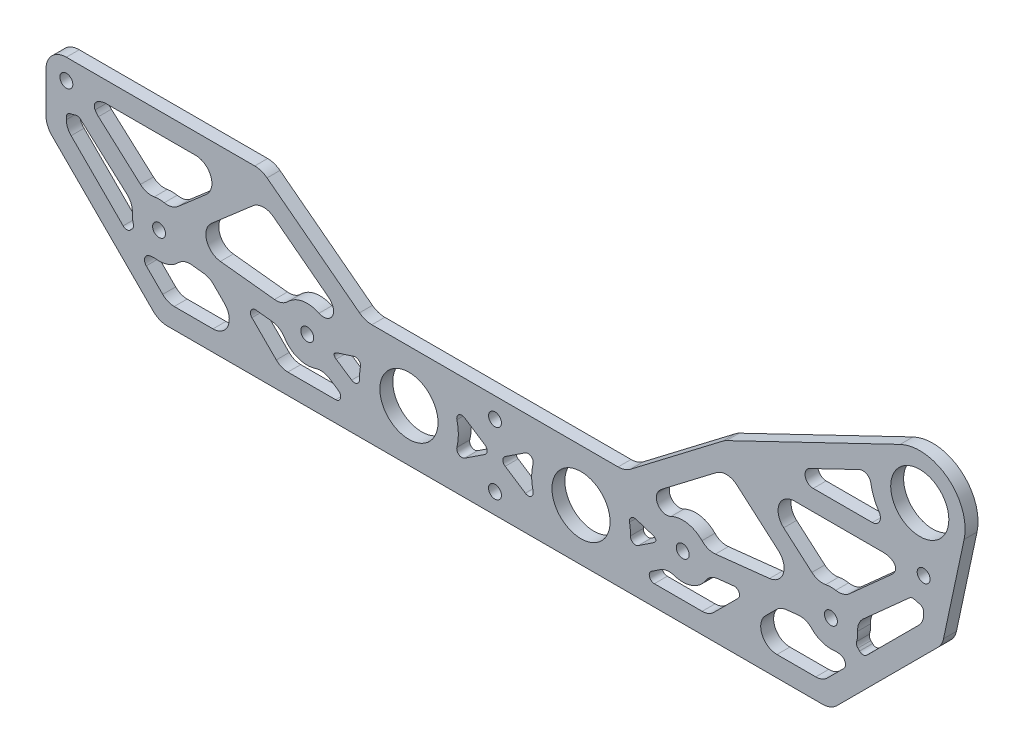
from build123d import *

# Parameters (mm, degrees)
SKETCH1_R           = 14.2875
SKETCH1_R_2         = 3.175
BOSS_EXTRUDE1_DEPTH = 6.35
FILLET1_R           = 10
CUT_EXTRUDE1_DEPTH  = 10
FILLET2_R           = 2.5
FILLET3_DEPTH       = 6.35
FILLET4_R           = 8
FILLET5_R           = 8
FILLET6_R           = 3
FILLET7_R           = 8
FILLET8_R           = 5
FILLET9_R           = 3
FILLET10_R          = 8
BOSS_EXTRUDE2_START = -6.35
SKETCH3_R           = 14.2875
BOSS_EXTRUDE2_DEPTH = 6.35
CUT_EXTRUDE2_DEPTH  = 10
FILLET11_R          = 4


with BuildPart() as part:
    # Sketch1 → Boss-Extrude1 (new body)
    with BuildSketch(Plane.XY):
        Polygon((-62.442934658, -37.279495554), (267.757065342, -37.279495554), (323.315335232, 18.278774336), (323.315335232, 52.320504446), (217.352871158, 52.320504446), (166.552871158, 13.520504446), (38.761259526, 13.520504446), (-12.038740474, 52.320504446), (-118.001204548, 52.320504446), (-118.001204548, 18.278774336), align=None)
        with Locations((60.373820223, -11.879495554)):
            Circle(SKETCH1_R, mode=Mode.SUBTRACT)
        with Locations((-62.442934658, 1.520504446)):
            Circle(SKETCH1_R_2, mode=Mode.SUBTRACT)
        with Locations((10.373820223, -6.424213816)):
            Circle(SKETCH1_R_2, mode=Mode.SUBTRACT)
        with Locations((102.657065342, -27.279495554)):
            Circle(SKETCH1_R_2, mode=Mode.SUBTRACT)
        with Locations((144.940310462, -11.879495554)):
            Circle(SKETCH1_R, mode=Mode.SUBTRACT)
        with Locations((194.940310462, -6.424213816)):
            Circle(SKETCH1_R_2, mode=Mode.SUBTRACT)
        with Locations((102.657065342, 3.520504446)):
            Circle(SKETCH1_R_2, mode=Mode.SUBTRACT)
        with Locations((267.757065342, 1.520504446)):
            Circle(SKETCH1_R_2, mode=Mode.SUBTRACT)
        with Locations((313.315335232, 42.320504446)):
            Circle(SKETCH1_R_2, mode=Mode.SUBTRACT)
        with Locations((-108.001204548, 42.320504446)):
            Circle(SKETCH1_R_2, mode=Mode.SUBTRACT)
    extrude(amount=BOSS_EXTRUDE1_DEPTH)

    # Fillet1
    fillet1_edges = [part.edges().sort_by_distance(p)[0] for p in [
        (-118.001204548, 18.278774336, 3.175),
        (-118.001204548, 52.320504446, 3.175),
        (-12.038740474, 52.320504446, 3.175),
        (38.761259526, 13.520504446, 3.175),
        (166.552871158, 13.520504446, 3.175),
        (217.352871158, 52.320504446, 3.175),
        (323.315335232, 52.320504446, 3.175),
        (323.315335232, 18.278774336, 3.175),
        (267.757065342, -37.279495554, 3.175),
        (-62.442934658, -37.279495554, 3.175),
    ]]
    fillet(fillet1_edges, radius=FILLET1_R)

    # Sketch2 → Cut-Extrude1 (cut)
    with BuildSketch(Plane.XY.offset(6.35)):
        with BuildLine():
            ThreePointArc((23.505920872, -7.486549706), (23.419545179, -8.265323632), (23.28702714, -9.037585605))
            Line((23.28702714, -9.037585605), (36.905820905, -18.135345959))
            ThreePointArc((36.905820905, -18.135345959), (36.127690836, -10.462503664), (37.794303215, -2.932536966))
            Line((37.794303215, -2.932536966), (23.505920872, -7.486549706))
        make_face()
        with BuildLine():
            Line((-74.858923583, 5.927753475), (-102.256554243, 30.463876853))
            ThreePointArc((-102.256554243, 30.463876853), (-105.054209768, 29.479326667), (-108.001204548, 29.145504446))
            Line((-108.001204548, 29.145504446), (-108.001204548, 22.42090996))
            Line((-108.001204548, 22.42090996), (-78.307400752, -7.272893836))
            Line((-78.307400752, -7.272893836), (-74.597651385, -3.563144469))
            ThreePointArc((-74.597651385, -3.563144469), (-75.612945288, 1.157951013), (-74.858923583, 5.927753475))
        make_face()
        with BuildLine():
            Line((-23.050139283, 42.320504446), (-94.826204548, 42.320504446))
            ThreePointArc((-94.826204548, 42.320504446), (-95.017343814, 40.084439722), (-95.585215622, 37.913255418))
            Line((-95.585215622, 37.913255418), (-68.187584962, 13.377132039))
            ThreePointArc((-68.187584962, 13.377132039), (-62.339595002, 14.695099162), (-56.512999229, 13.285558242))
            Line((-56.512999229, 13.285558242), (-23.050139283, 42.320504446))
        make_face()
        with BuildLine():
            Line((-67.526583573, -10.63421228), (-71.23633294, -14.343961648))
            Line((-71.23633294, -14.343961648), (-58.300799034, -27.279495554))
            Line((-58.300799034, -27.279495554), (-16.619224161, -27.279495554))
            Line((-16.619224161, -27.279495554), (-37.688728757, -6.209990957))
            Line((-37.688728757, -6.209990957), (-50.867789262, -4.772081195))
            ThreePointArc((-50.867789262, -4.772081195), (-58.069603335, -10.907471984), (-67.526583573, -10.63421228))
        make_face()
        with BuildLine():
            Line((30.003625706, 7.626245825), (-11.363222422, 39.221397545))
            Line((-11.363222422, 39.221397545), (-49.959338032, 5.732444651))
            ThreePointArc((-49.959338032, 5.732444651), (-49.868096719, 5.45167168), (-49.783169494, 5.168924788))
            Line((-49.783169494, 5.168924788), (-1.201325173, -0.131628174))
            ThreePointArc((-1.201325173, -0.131628174), (9.059387493, 6.685053578), (20.46921657, 2.041221648))
            Line((20.46921657, 2.041221648), (32.642653903, 5.921156225))
            ThreePointArc((32.642653903, 5.921156225), (31.289604918, 6.721797881), (30.003625706, 7.626245825))
        make_face()
        with BuildLine():
            Line((-21.814640677, -7.941943413), (-2.477088537, -27.279495554))
            Line((-2.477088537, -27.279495554), (32.591759865, -27.279495554))
            Line((32.591759865, -27.279495554), (17.732180345, -17.352853315))
            ThreePointArc((17.732180345, -17.352853315), (5.870863239, -18.805813204), (-2.285944941, -10.072634157))
            Line((-2.285944941, -10.072634157), (-21.814640677, -7.941943413))
        make_face()
        with BuildLine():
            Line((187.581950339, -17.352853315), (172.722370819, -27.279495554))
            Line((172.722370819, -27.279495554), (207.791219222, -27.279495554))
            Line((207.791219222, -27.279495554), (227.128771362, -7.941943413))
            Line((227.128771362, -7.941943413), (207.600075626, -10.072634157))
            ThreePointArc((207.600075626, -10.072634157), (199.443267446, -18.805813204), (187.581950339, -17.352853315))
        make_face()
        with BuildLine():
            Line((243.002859442, -6.209990957), (221.933354845, -27.279495554))
            Line((221.933354845, -27.279495554), (263.614929719, -27.279495554))
            Line((263.614929719, -27.279495554), (276.550463625, -14.343961648))
            Line((276.550463625, -14.343961648), (272.840714257, -10.63421228))
            ThreePointArc((272.840714257, -10.63421228), (263.38373402, -10.907471984), (256.181919946, -4.772081195))
            Line((256.181919946, -4.772081195), (243.002859442, -6.209990957))
        make_face()
        with BuildLine():
            Line((168.408309779, -18.135345959), (182.027103545, -9.037585605))
            ThreePointArc((182.027103545, -9.037585605), (181.894585505, -8.265323632), (181.808209813, -7.486549706))
            Line((181.808209813, -7.486549706), (167.519827469, -2.932536966))
            ThreePointArc((167.519827469, -2.932536966), (169.186439849, -10.462503664), (168.408309779, -18.135345959))
        make_face()
        with BuildLine():
            ThreePointArc((175.310504979, 7.626245825), (174.024525767, 6.721797881), (172.671476782, 5.921156225))
            Line((172.671476782, 5.921156225), (184.844914115, 2.041221648))
            ThreePointArc((184.844914115, 2.041221648), (196.254743191, 6.685053578), (206.515455858, -0.131628174))
            Line((206.515455858, -0.131628174), (255.097300178, 5.168924788))
            ThreePointArc((255.097300178, 5.168924788), (255.182227404, 5.45167168), (255.273468717, 5.732444651))
            Line((255.273468717, 5.732444651), (216.677353107, 39.221397545))
            Line((216.677353107, 39.221397545), (175.310504979, 7.626245825))
        make_face()
        with BuildLine():
            Line((279.911782069, -3.563144469), (283.621531436, -7.272893836))
            Line((283.621531436, -7.272893836), (313.315335232, 22.42090996))
            Line((313.315335232, 22.42090996), (313.315335232, 29.145504446))
            ThreePointArc((313.315335232, 29.145504446), (310.368340453, 29.479326667), (307.570684928, 30.463876853))
            Line((307.570684928, 30.463876853), (280.173054268, 5.927753475))
            ThreePointArc((280.173054268, 5.927753475), (280.927075973, 1.157951013), (279.911782069, -3.563144469))
        make_face()
        with BuildLine():
            Line((228.364269968, 42.320504446), (261.827129914, 13.285558242))
            ThreePointArc((261.827129914, 13.285558242), (267.653725687, 14.695099162), (273.501715647, 13.377132039))
            Line((273.501715647, 13.377132039), (300.899346307, 37.913255418))
            ThreePointArc((300.899346307, 37.913255418), (300.331474499, 40.084439722), (300.140335232, 42.320504446))
            Line((300.140335232, 42.320504446), (228.364269968, 42.320504446))
        make_face()
        with BuildLine():
            Line((124.499254422, 1.237130698), (104.481636284, -11.879495554))
            Line((104.481636284, -11.879495554), (124.499254422, -24.996121805))
            ThreePointArc((124.499254422, -24.996121805), (120.652810462, -11.879495554), (124.499254422, 1.237130698))
        make_face()
        with BuildLine():
            Line((100.832494401, -11.879495554), (80.814876263, 1.237130698))
            ThreePointArc((80.814876263, 1.237130698), (84.661320223, -11.879495554), (80.814876263, -24.996121805))
            Line((80.814876263, -24.996121805), (100.832494401, -11.879495554))
        make_face()
    extrude(amount=-CUT_EXTRUDE1_DEPTH, mode=Mode.SUBTRACT)

    # Fillet2
    # the kernel refuses this fillet: 2.5 mm, written as the material it adds along each edge
    with BuildSketch(Plane(origin=(124.499254422, -24.996121805, 6.35), x_dir=(-0.8364298099761919, 0.5480740579366914, 0), z_dir=(0, 0, -1)), Plane(origin=(80.814876263, 1.237130698, 6.35), x_dir=(0.8364298099761912, -0.5480740579366923, 0), z_dir=(0, 0, -1))) as fillet2_piece_1:
        with BuildLine():
            CenterArc((8.270761151, 2.5), FILLET2_R, 132.738385679, 137.261614321)
            ThreePointArc((6.574131455, 4.336150232), (3.463988922, 1.899838021), (0, 0))
            Line((0, 0), (8.270761151, 0))
        make_face()
    extrude(amount=6.35)
    with BuildSketch(Plane(origin=(104.481636284, -11.879495554, 6.35), x_dir=(0.836429809976191, 0.5480740579366925, 0), z_dir=(0, 0, -1)), Plane(origin=(100.832494401, -11.879495554, 6.35), x_dir=(-0.836429809976192, -0.5480740579366911, 0), z_dir=(0, 0, -1))) as fillet2_piece_2:
        with BuildLine():
            CenterArc((FILLET2_R * 1.52612552604, FILLET2_R), FILLET2_R, 156.469970738, 113.530029262)
            Line((FILLET2_R * 0.609274565772, FILLET2_R * 1.39922965403), (0, 0))
            Line((0, 0), (FILLET2_R * 1.52612552604, 0))
        make_face()
    extrude(amount=6.35)
    with BuildSketch(Plane(origin=(124.499254422, 1.237130698, 6.35), x_dir=(-0.8364298099761911, -0.5480740579366926, 0), z_dir=(0, 0, -1)), Plane(origin=(80.814876263, -24.996121805, 6.35), x_dir=(0.8364298099761913, 0.5480740579366921, 0), z_dir=(0, 0, -1))) as fillet2_piece_3:
        with BuildLine():
            CenterArc((8.270761151, -2.5), FILLET2_R, 90, 137.261614321)
            ThreePointArc((6.574131455, -4.336150232), (3.463988922, -1.899838021), (0, 0))
            Line((0, 0), (8.270761151, 0))
        make_face()
    extrude(amount=6.35)
    with BuildSketch(Plane(origin=(36.905820905, -18.135345959, 6.35), x_dir=(-0.8315267709778132, 0.5554846794891928, 0), z_dir=(0, 0, -1))) as fillet2_piece_4:
        with BuildLine():
            CenterArc((5.637586761, 2.5), FILLET2_R, 144.019234869, 125.980765131)
            ThreePointArc((3.614551073, 3.968784057), (1.917261006, 1.884223289), (0, 0))
            Line((0, 0), (5.637586761, 0))
        make_face()
    extrude(amount=6.35)
    with BuildSketch(Plane(origin=(37.794303215, -2.932536966, 6.35), x_dir=(-0.9527771354410546, -0.3036704302047504, 0), z_dir=(0, 0, -1))) as fillet2_piece_5:
        with BuildLine():
            CenterArc((4.690805929, -2.5), FILLET2_R, 90, 118.741955759)
            ThreePointArc((2.498820236, -3.702164183), (1.334695889, -1.793517434), (0, 0))
            Line((0, 0), (4.690805929, 0))
        make_face()
    extrude(amount=6.35)
    with BuildSketch(Plane(origin=(23.28702714, -9.037585605, 6.35), x_dir=(0.14435302535723496, 0.989526252340085, 0), z_dir=(0, 0, -1)), Plane(origin=(181.808209813, -7.486549706, 6.35), x_dir=(0.13512930422682767, -0.9908279725255911, 0), z_dir=(0, 0, -1)), Plane(origin=(307.570684928, 30.463876853, 6.35), x_dir=(0.9224742738611128, -0.3860585629984297, 0), z_dir=(0, 0, -1))) as fillet2_piece_6:
        with BuildLine():
            CenterArc((1.580869434, 2.496243903), FILLET2_R, 205.444288667, 61.414548907)
            Line((-0.676639225, 1.422160733), (0, 0))
            ThreePointArc((0, 0), (0.721939507, 0.019794629), (1.443879015, 0))
        make_face()
    extrude(amount=6.35)
    with BuildSketch(Plane(origin=(23.505920872, -7.486549706, 6.35), x_dir=(0.9527771354410546, 0.3036704302047506, 0), z_dir=(0, 0, -1)), Plane(origin=(182.027103545, -9.037585605, 6.35), x_dir=(-0.8315267709778119, -0.5554846794891947, 0), z_dir=(0, 0, -1)), Plane(origin=(-74.597651385, -3.563144469, 6.35), x_dir=(-0.7071067811865465, -0.7071067811865487, 0), z_dir=(0, 0, -1)), Plane(origin=(-102.256554243, 30.463876853, 6.35), x_dir=(0.7449378564648427, -0.667133862133804, 0), z_dir=(0, 0, -1))) as fillet2_piece_7:
        with BuildLine():
            CenterArc((1.574922789, 2.5), FILLET2_R, 208.585451093, 61.414548907)
            ThreePointArc((-0.62033846, 1.303827751), (-0.292294611, 0.660418307), (0, 0))
            Line((0, 0), (1.574922789, 0))
        make_face()
    extrude(amount=6.35)
    with BuildSketch(Plane(origin=(168.408309779, -18.135345959, 6.35), x_dir=(0.8315267709778126, 0.555484679489194, 0), z_dir=(0, 0, -1))) as fillet2_piece_8:
        with BuildLine():
            CenterArc((5.637586761, -2.5), FILLET2_R, 90, 125.980765131)
            ThreePointArc((3.614551073, -3.968784057), (1.917261006, -1.884223289), (0, 0))
            Line((0, 0), (5.637586761, 0))
        make_face()
    extrude(amount=6.35)
    with BuildSketch(Plane(origin=(167.519827469, -2.932536966, 6.35), x_dir=(0.9527771354410542, -0.3036704302047514, 0), z_dir=(0, 0, -1))) as fillet2_piece_9:
        with BuildLine():
            CenterArc((4.690805929, 2.5), FILLET2_R, 151.258044241, 118.741955759)
            ThreePointArc((2.498820236, 3.702164183), (1.334695889, 1.793517434), (0, 0))
            Line((0, 0), (4.690805929, 0))
        make_face()
    extrude(amount=6.35)
    with BuildSketch(Plane(origin=(-21.814640677, -7.941943413, 6.35), x_dir=(0.9941005983250841, -0.10846197679237511, 0), z_dir=(0, 0, -1)), Plane(origin=(227.128771362, -7.941943413, 6.35), x_dir=(-0.7071067811865478, -0.7071067811865472, 0), z_dir=(0, 0, -1))) as fillet2_piece_10:
        with BuildLine():
            CenterArc((FILLET2_R * 2.8417642098, FILLET2_R), FILLET2_R, 128.773337141, 141.226662859)
            Line((FILLET2_R * 2.21552313484, FILLET2_R * 1.77962947355), (0, 0))
            Line((0, 0), (FILLET2_R * 2.8417642098, 0))
        make_face()
    extrude(amount=6.35)
    with BuildSketch(Plane(origin=(32.591759865, -27.279495554, 6.35), x_dir=(-1, 0, 0), z_dir=(0, 0, -1)), Plane(origin=(172.722370819, -27.279495554, 6.35), x_dir=(0.8315267709778129, 0.5554846794891936, 0), z_dir=(0, 0, -1))) as fillet2_piece_11:
        with BuildLine():
            CenterArc((FILLET2_R * 3.2971688304, FILLET2_R), FILLET2_R, 123.74410479, 146.25589521)
            Line((FILLET2_R * 2.74168415091, FILLET2_R * 1.83152677098), (0, 0))
            Line((0, 0), (FILLET2_R * 3.2971688304, 0))
        make_face()
    extrude(amount=6.35)
    with BuildSketch(Plane(origin=(279.911782069, -3.563144469, 6.35), x_dir=(0.7071067811865567, -0.7071067811865384, 0), z_dir=(0, 0, -1))) as fillet2_piece_12:
        with BuildLine():
            CenterArc((1.574922789, -2.5), FILLET2_R, 90, 61.414548907)
            ThreePointArc((-0.62033846, -1.303827751), (-0.292294611, -0.660418307), (0, 0))
            Line((0, 0), (1.574922789, 0))
        make_face()
    extrude(amount=6.35)
    with BuildSketch(Plane(origin=(283.621531436, -7.272893836, 6.35), x_dir=(-0.707106781186556, 0.7071067811865389, 0), z_dir=(0, 0, -1))) as fillet2_piece_13:
        with BuildLine():
            CenterArc((FILLET2_R, FILLET2_R), FILLET2_R, 180, 90)
            Line((0, FILLET2_R), (0, 0))
            Line((0, 0), (FILLET2_R, 0))
        make_face()
    extrude(amount=6.35)
    with BuildSketch(Plane(origin=(-78.307400752, -7.272893836, 6.35), x_dir=(0.7071067811865476, 0.7071067811865476, 0), z_dir=(0, 0, -1))) as fillet2_piece_14:
        with BuildLine():
            CenterArc((FILLET2_R, -FILLET2_R), FILLET2_R, 90, 90)
            Line((0, -FILLET2_R), (0, 0))
            Line((0, 0), (FILLET2_R, 0))
        make_face()
    extrude(amount=6.35)
    with BuildSketch(Plane(origin=(-108.001204548, 29.145504446, 6.35), x_dir=(0.996794764075885, 0.08000123943352926, 0), z_dir=(0, 0, -1))) as fillet2_piece_15:
        with BuildLine():
            CenterArc((2.308035758, 2.49198691), FILLET2_R, 184.588636978, 80.822726043)
            Line((-0.183951153, 2.291983812), (0, 0))
            ThreePointArc((0, 0), (1.05401633, 0.042228983), (2.108032659, 0))
        make_face()
    extrude(amount=6.35)
    with BuildSketch(Plane(origin=(313.315335232, 29.145504446, 6.35), x_dir=(0, -1, 0), z_dir=(0, 0, -1))) as fillet2_piece_16:
        with BuildLine():
            CenterArc((2.299353783, 2.5), FILLET2_R, 189.177273957, 80.822726043)
            ThreePointArc((-0.168645225, 2.101275917), (-0.042228983, 1.05401633), (0, 0))
            Line((0, 0), (2.299353783, 0))
        make_face()
    extrude(amount=6.35)

    # Fillet3: read off the stored shape, not the designer's step
    # Fillet3 outline → Fillet3 (add)
    with BuildSketch(Plane.XY):
        with BuildLine():
            ThreePointArc((211.014076866, 0.359196726), (207.431725827, 0.786667832), (204.401466543, 2.744600208))
            ThreePointArc((204.401466543, 2.744600208), (205.556320418, 1.37841123), (206.515455858, -0.131628174))
            Line((206.515455858, -0.131628174), (211.014076866, 0.359196726))
        make_face()
        with BuildLine():
            Line((172.671476782, 5.921156225), (184.844914115, 2.041221648))
            ThreePointArc((184.844914115, 2.041221648), (181.600857992, 8.411550009), (184.744728864, 14.831912887))
            Line((184.744728864, 14.831912887), (175.310504979, 7.626245825))
            ThreePointArc((175.310504979, 7.626245825), (174.024525767, 6.721797881), (172.671476782, 5.921156225))
        make_face()
        with BuildLine():
            ThreePointArc((253.267424296, 7.473042793), (254.289203208, 6.405834356), (255.097300178, 5.168924788))
            ThreePointArc((255.097300178, 5.168924788), (255.182227404, 5.45167168), (255.273468717, 5.732444651))
            Line((255.273468717, 5.732444651), (253.267424296, 7.473042793))
        make_face()
        with BuildLine():
            Line((216.677353107, 39.221397545), (211.499590999, 35.266728848))
            ThreePointArc((211.499590999, 35.266728848), (216.60505587, 36.90513128), (221.598403693, 34.951516272))
            Line((221.598403693, 34.951516272), (216.677353107, 39.221397545))
        make_face()
        with BuildLine():
            ThreePointArc((0.912664141, 2.744600208), (-2.117595142, 0.786667832), (-5.699946181, 0.359196726))
            Line((-5.699946181, 0.359196726), (-1.201325173, -0.131628174))
            ThreePointArc((-1.201325173, -0.131628174), (-0.242189733, 1.37841123), (0.912664141, 2.744600208))
        make_face()
        with BuildLine():
            ThreePointArc((-49.959338032, 5.732444651), (-49.868096719, 5.45167168), (-49.783169494, 5.168924788))
            ThreePointArc((-49.783169494, 5.168924788), (-48.975072523, 6.405834356), (-47.953293611, 7.473042793))
            Line((-47.953293611, 7.473042793), (-49.959338032, 5.732444651))
        make_face()
        with BuildLine():
            ThreePointArc((20.56940182, 14.831912887), (23.713272692, 8.411550009), (20.46921657, 2.041221648))
            Line((20.46921657, 2.041221648), (32.642653903, 5.921156225))
            ThreePointArc((32.642653903, 5.921156225), (31.289604918, 6.721797881), (30.003625706, 7.626245825))
            Line((30.003625706, 7.626245825), (20.56940182, 14.831912887))
        make_face()
        with BuildLine():
            Line((-11.363222422, 39.221397545), (-16.284273008, 34.951516272))
            ThreePointArc((-16.284273008, 34.951516272), (-11.290925185, 36.90513128), (-6.185460314, 35.266728848))
            Line((-6.185460314, 35.266728848), (-11.363222422, 39.221397545))
        make_face()
        with BuildLine():
            Line((-58.300799034, -27.279495554), (-54.987090535, -27.279495554))
            ThreePointArc((-54.987090535, -27.279495554), (-58.048557994, -26.670531814), (-60.643944784, -24.936349803))
            Line((-60.643944784, -24.936349803), (-58.300799034, -27.279495554))
        make_face()
        with BuildLine():
            ThreePointArc((-30.27607841, -13.622641304), (-28.5418964, -22.340963013), (-35.93293266, -27.279495554))
            Line((-35.93293266, -27.279495554), (-16.619224161, -27.279495554))
            Line((-16.619224161, -27.279495554), (-30.27607841, -13.622641304))
        make_face()
        with BuildLine():
            Line((-67.526583573, -10.63421228), (-70.726466387, -13.834095095))
            ThreePointArc((-70.726466387, -13.834095095), (-67.665859968, -11.923948803), (-64.077242842, -11.552737759))
            ThreePointArc((-64.077242842, -11.552737759), (-65.833164615, -11.210833497), (-67.526583573, -10.63421228))
        make_face()
        with BuildLine():
            ThreePointArc((-52.981778576, -7.648309578), (-49.951519293, -5.690377201), (-46.369168254, -5.262906096))
            Line((-46.369168254, -5.262906096), (-50.867789262, -4.772081195))
            ThreePointArc((-50.867789262, -4.772081195), (-51.826924702, -6.2821206), (-52.981778576, -7.648309578))
        make_face()
        with BuildLine():
            Line((221.933354845, -27.279495554), (241.247063344, -27.279495554))
            ThreePointArc((241.247063344, -27.279495554), (233.856027084, -22.340963013), (235.590209095, -13.622641304))
            Line((235.590209095, -13.622641304), (221.933354845, -27.279495554))
        make_face()
        with BuildLine():
            Line((256.181919946, -4.772081195), (251.683298938, -5.262906096))
            ThreePointArc((251.683298938, -5.262906096), (255.265649978, -5.690377201), (258.295909261, -7.648309578))
            ThreePointArc((258.295909261, -7.648309578), (257.141055386, -6.2821206), (256.181919946, -4.772081195))
        make_face()
        with BuildLine():
            ThreePointArc((269.391373527, -11.552737759), (272.979990652, -11.923948803), (276.040597072, -13.834095095))
            Line((276.040597072, -13.834095095), (272.840714257, -10.63421228))
            ThreePointArc((272.840714257, -10.63421228), (271.147295299, -11.210833497), (269.391373527, -11.552737759))
        make_face()
        with BuildLine():
            Line((313.315335232, 22.42090996), (313.315335232, 25.734618459))
            ThreePointArc((313.315335232, 25.734618459), (312.706371492, 22.673151), (310.972189482, 20.077764209))
            Line((310.972189482, 20.077764209), (313.315335232, 22.42090996))
        make_face()
        with BuildLine():
            Line((-108.001204548, 22.42090996), (-105.658058797, 20.077764209))
            ThreePointArc((-105.658058797, 20.077764209), (-107.392240808, 22.673151), (-108.001204548, 25.734618459))
            Line((-108.001204548, 25.734618459), (-108.001204548, 22.42090996))
        make_face()
        with BuildLine():
            ThreePointArc((-94.710843669, 39.231452318), (-91.910717066, 41.506865938), (-88.395577167, 42.320504446))
            Line((-88.395577167, 42.320504446), (-94.826204548, 42.320504446))
            ThreePointArc((-94.826204548, 42.320504446), (-95.017343814, 40.084439722), (-95.585215622, 37.913255418))
            Line((-95.585215622, 37.913255418), (-92.214135174, 34.89426276))
            ThreePointArc((-92.214135174, 34.89426276), (-93.810362745, 36.862603833), (-94.710843669, 39.231452318))
        make_face()
        with BuildLine():
            Line((-23.050139283, 42.320504446), (-44.477079813, 42.320504446))
            ThreePointArc((-44.477079813, 42.320504446), (-36.98241748, 37.118724686), (-39.234150855, 28.278013574))
            Line((-39.234150855, 28.278013574), (-23.050139283, 42.320504446))
        make_face()
        with BuildLine():
            ThreePointArc((-64.794001652, 14.484034405), (-68.39760622, 14.657252847), (-71.55866541, 16.396124697))
            Line((-71.55866541, 16.396124697), (-68.187584962, 13.377132039))
            ThreePointArc((-68.187584962, 13.377132039), (-66.528453946, 14.04604464), (-64.794001652, 14.484034405))
        make_face()
        with BuildLine():
            Line((-56.512999229, 13.285558242), (-53.094975386, 16.251298127))
            ThreePointArc((-53.094975386, 16.251298127), (-56.282922876, 14.562226986), (-59.888801275, 14.445558708))
            ThreePointArc((-59.888801275, 14.445558708), (-58.161433032, 13.980414913), (-56.512999229, 13.285558242))
        make_face()
        with BuildLine():
            ThreePointArc((300.024974354, 39.231452318), (299.12449343, 36.862603833), (297.528265858, 34.89426276))
            Line((297.528265858, 34.89426276), (300.899346307, 37.913255418))
            ThreePointArc((300.899346307, 37.913255418), (300.331474499, 40.084439722), (300.140335232, 42.320504446))
            Line((300.140335232, 42.320504446), (293.709707851, 42.320504446))
            ThreePointArc((293.709707851, 42.320504446), (297.224847751, 41.506865938), (300.024974354, 39.231452318))
        make_face()
        with BuildLine():
            Line((273.501715647, 13.377132039), (276.872796095, 16.396124697))
            ThreePointArc((276.872796095, 16.396124697), (273.711736905, 14.657252847), (270.108132336, 14.484034405))
            ThreePointArc((270.108132336, 14.484034405), (271.842584631, 14.04604464), (273.501715647, 13.377132039))
        make_face()
        with BuildLine():
            ThreePointArc((244.54828154, 28.278013574), (242.296548164, 37.118724686), (249.791210497, 42.320504446))
            Line((249.791210497, 42.320504446), (228.364269968, 42.320504446))
            Line((228.364269968, 42.320504446), (244.54828154, 28.278013574))
        make_face()
        with BuildLine():
            ThreePointArc((261.827129914, 13.285558242), (263.475563717, 13.980414913), (265.202931959, 14.445558708))
            ThreePointArc((265.202931959, 14.445558708), (261.59705356, 14.562226986), (258.409106071, 16.251298127))
            Line((258.409106071, 16.251298127), (261.827129914, 13.285558242))
        make_face()
        with BuildLine():
            ThreePointArc((280.900420623, 2.433103461), (281.468499861, 5.995863135), (283.544134716, 8.946746132))
            Line((283.544134716, 8.946746132), (280.173054268, 5.927753475))
            ThreePointArc((280.173054268, 5.927753475), (280.655637502, 4.205175982), (280.900420623, 2.433103461))
        make_face()
        with BuildLine():
            ThreePointArc((183.819027546, -19.866597953), (187.193607633, -18.590596485), (190.785655576, -18.926992218))
            ThreePointArc((190.785655576, -18.926992218), (189.130245318, -18.248923877), (187.581950339, -17.352853315))
            Line((187.581950339, -17.352853315), (183.819027546, -19.866597953))
        make_face()
        with BuildLine():
            ThreePointArc((206.156066314, -13.337060238), (208.692812831, -10.771736161), (212.098696634, -9.581809257))
            Line((212.098696634, -9.581809257), (207.600075626, -10.072634157))
            ThreePointArc((207.600075626, -10.072634157), (206.989138013, -11.753977379), (206.156066314, -13.337060238))
        make_face()
        with BuildLine():
            ThreePointArc((-6.784565949, -9.581809257), (-3.378682147, -10.771736161), (-0.84193563, -13.337060238))
            ThreePointArc((-0.84193563, -13.337060238), (-1.675007328, -11.753977378), (-2.285944941, -10.072634157))
            Line((-2.285944941, -10.072634157), (-6.784565949, -9.581809257))
        make_face()
        with BuildLine():
            ThreePointArc((17.732180345, -17.352853315), (16.183885366, -18.248923877), (14.528475108, -18.926992218))
            ThreePointArc((14.528475108, -18.926992218), (18.120523051, -18.590596485), (21.495103139, -19.866597953))
            Line((21.495103139, -19.866597953), (17.732180345, -17.352853315))
        make_face()
        with BuildLine():
            ThreePointArc((-78.230004032, 8.946746132), (-76.154369176, 5.995863135), (-75.586289939, 2.433103461))
            ThreePointArc((-75.586289939, 2.433103461), (-75.341506817, 4.205175982), (-74.858923583, 5.927753475))
            Line((-74.858923583, 5.927753475), (-78.230004032, 8.946746132))
        make_face()
    extrude(amount=FILLET3_DEPTH)

    # Fillet4
    fillet4_edges = [part.edges().sort_by_distance(p)[0] for p in [
        (-49.783169494, 5.168924788, 3.175),
        (255.097300178, 5.168924788, 3.175),
    ]]
    fillet(fillet4_edges, radius=FILLET4_R)

    # Fillet5
    # the kernel refuses this fillet: 8 mm, written as the material it adds along each edge
    with BuildSketch(Plane(origin=(276.550463625, -14.343961648, 6.35), x_dir=(-0.7071067811865465, -0.7071067811865486, 0), z_dir=(0, 0, -1))) as fillet5_piece_1:
        with BuildLine():
            CenterArc((3.319191964, 8), FILLET5_R, 245.487044087, 24.512955913)
            Line((0, 0.721060194), (-0.066383839, 0.575481398))
            ThreePointArc((-0.066383839, 0.575481398), (-0.16, 0.360530097), (-0.16, 0))
            Line((-0.16, 0), (0, -0.16))
            Line((0, -0.16), (3.319191964, -0.16))
            Line((3.319191964, -0.16), (3.319191964, 0))
        make_face()
    extrude(amount=6.35)
    with BuildSketch(Plane(origin=(-71.23633294, -14.343961648, 6.35), x_dir=(0.7071067811865467, -0.7071067811865483, 0), z_dir=(0, 0, -1))) as fillet5_piece_2:
        with BuildLine():
            CenterArc((3.319191965, -8), FILLET5_R, 90, 24.512955918)
            Line((0, -0.721060194), (-0.066383839, -0.575481398))
            ThreePointArc((-0.066383839, -0.575481398), (-0.16, -0.360530097), (-0.16, 0))
            Line((-0.16, 0), (0, 0.16))
            Line((0, 0.16), (3.319191965, 0.16))
            Line((3.319191965, 0.16), (3.319191965, 0))
        make_face()
    extrude(amount=6.35)

    # Fillet6
    fillet6_edges = [part.edges().sort_by_distance(p)[0] for p in [
        (276.040597072, -13.834095095, 3.175),
        (-70.726466387, -13.834095095, 3.175),
    ]]
    fillet(fillet6_edges, radius=FILLET6_R)

    # Fillet7
    fillet7_edges = [part.edges().sort_by_distance(p)[0] for p in [
        (-2.477088537, -27.279495554, 3.175),
        (207.791219222, -27.279495554, 3.175),
        (263.614929719, -27.279495554, 3.175),
    ]]
    fillet(fillet7_edges, radius=FILLET7_R)

    # Fillet8
    fillet8_edges = [part.edges().sort_by_distance(p)[0] for p in [
        (184.844914115, 2.041221648, 3.175),
        (20.46921657, 2.041221648, 3.175),
    ]]
    fillet(fillet8_edges, radius=FILLET8_R)

    # Fillet9
    fillet9_edges = [part.edges().sort_by_distance(p)[0] for p in [
        (-94.710843669, 39.231452318, 3.175),
        (300.024974354, 39.231452318, 3.175),
    ]]
    fillet(fillet9_edges, radius=FILLET9_R)

    # Fillet10
    fillet10_edges = [part.edges().sort_by_distance(p)[0] for p in [
        (-37.688728757, -6.209990957, 3.175),
        (243.002859442, -6.209990957, 3.175),
    ]]
    fillet(fillet10_edges, radius=FILLET10_R)

    # Sketch3 → Boss-Extrude2 (add)
    with BuildSketch(Plane(origin=(0, 0, 0), x_dir=(-1, 0, 0), z_dir=(0, 0, -1)).offset(BOSS_EXTRUDE2_START)):
        with BuildLine():
            Line((-216.398971943, 51.331571147), (-301.755950182, 92.403919453))
            ThreePointArc((-301.755950182, 92.403919453), (-325.198451885, 89.838498961), (-333.214589736, 67.660270845))
            Line((-333.214589736, 67.660270845), (-323.094285793, 20.329947043))
            ThreePointArc((-323.094285793, 20.329947043), (-323.259919326, 21.369602586), (-323.315335232, 22.42090996))
            Line((-323.315335232, 22.42090996), (-323.315335232, 42.320504446))
            ThreePointArc((-323.315335232, 42.320504446), (-320.386403044, 49.391572258), (-313.315335232, 52.320504446))
            Line((-313.315335232, 52.320504446), (-220.734946679, 52.320504446))
            ThreePointArc((-220.734946679, 52.320504446), (-218.511286072, 52.070136927), (-216.398971943, 51.331571147))
        make_face()
        with Locations((-311.419753672, 72.320504446)):
            Circle(SKETCH3_R, mode=Mode.SUBTRACT)
    extrude(amount=BOSS_EXTRUDE2_DEPTH)

    # Sketch4 → Cut-Extrude2 (cut)
    with BuildSketch(Plane.XY.offset(6.35)):
        with BuildLine():
            ThreePointArc((287.213793808, 74.309012247), (289.474299765, 61.914750796), (297.639962083, 52.320504446))
            Line((297.639962083, 52.320504446), (293.709707851, 52.320504446))
            Line((293.709707851, 52.320504446), (249.791210497, 52.320504446))
            Line((249.791210497, 52.320504446), (241.517049909, 52.320504446))
            Line((241.517049909, 52.320504446), (287.213793808, 74.309012247))
        make_face()
    extrude(amount=-CUT_EXTRUDE2_DEPTH, mode=Mode.SUBTRACT)

    # Fillet11
    fillet11_edges = [part.edges().sort_by_distance(p)[0] for p in [
        (287.213793808, 74.309012247, 3.175),
        (297.639962083, 52.320504446, 3.175),
        (241.517049909, 52.320504446, 3.175),
    ]]
    fillet(fillet11_edges, radius=FILLET11_R)


solid = part.part
